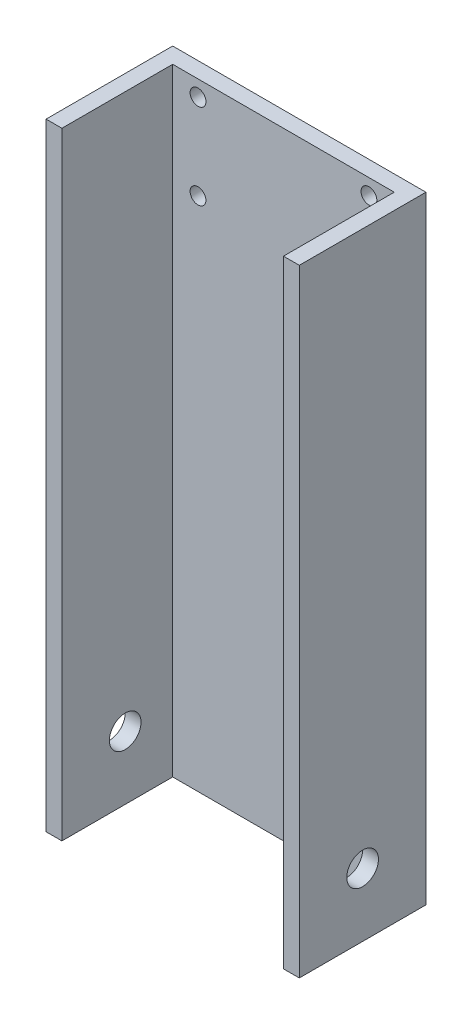
from build123d import *

# Parameters (mm, degrees)
BOSS_EXTRUDE1_DEPTH = 123.825
SKETCH2_R           = 3.175
CUT_EXTRUDE1_DEPTH  = 70
SKETCH3_R           = 1.5875
CUT_EXTRUDE2_DEPTH  = 70


with BuildPart() as part:
    # Sketch1 → Boss-Extrude1 (new body)
    with BuildSketch(Plane(origin=(0, 0, 0), x_dir=(1, 0, 0), z_dir=(0, 1, 0))):
        Polygon((25.4, 0), (25.4, 25.4), (-25.4, 25.4), (-25.4, 0), (-22.225, 0), (-22.225, 22.225), (22.225, 22.225), (22.225, 0), align=None)
    extrude(amount=BOSS_EXTRUDE1_DEPTH)

    # Sketch2 → Cut-Extrude1 (cut)
    with BuildSketch(Plane(origin=(25.4, 0, 0), x_dir=(0, 0, -1), z_dir=(1, 0, 0))):
        with Locations((12.7, 12.7)):
            Circle(SKETCH2_R)
    extrude(amount=-CUT_EXTRUDE1_DEPTH, mode=Mode.SUBTRACT)

    # Sketch3 → Cut-Extrude2 (cut)
    with BuildSketch(Plane(origin=(0, 0, -25.4), x_dir=(-1, 0, 0), z_dir=(0, 0, -1))):
        with Locations((17.145, 103.505)):
            Circle(SKETCH3_R)
        with Locations((17.145, 120.65)):
            Circle(SKETCH3_R)
        with Locations((-17.145, 103.505)):
            Circle(SKETCH3_R)
        with Locations((-17.145, 120.65)):
            Circle(SKETCH3_R)
    extrude(amount=-CUT_EXTRUDE2_DEPTH, mode=Mode.SUBTRACT)


solid = part.part
